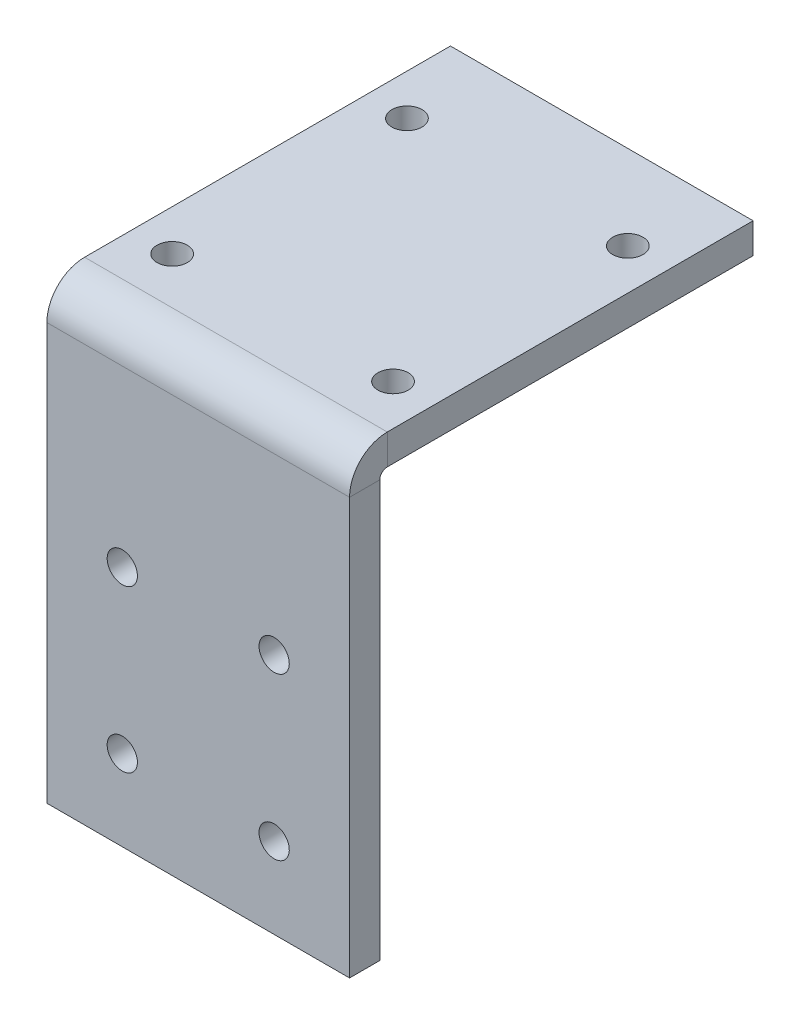
from build123d import *

# Parameters (mm, degrees)
SKETCH1_W                    = 30
SKETCH1_H                    = 40
BASE_FLANGE1_DEPTH           = 3
EDGE_FLANGE1_STRIP_W         = 13.4732
EDGE_FLANGE1_STRIP_H         = 3
EDGE_FLANGE1_STRIP_CUT_DEPTH = 30
EDGE_FLANGE1_DEPTH           = 30
SKETCH9_R                    = 1.5
CUT_EXTRUDE1_DEPTH           = 10
SKETCH10_R                   = 1.5
CUT_EXTRUDE2_DEPTH           = 10


# Sheet-metal steps are written as plain solids
with BuildPart() as part:
    # Sketch1 → Base-Flange1 (new body)
    with BuildSketch(Plane(origin=(0, 0, 0), x_dir=(1, 0, 0), z_dir=(0, 1, 0))):
        Rectangle(SKETCH1_W, SKETCH1_H)
    extrude(amount=-BASE_FLANGE1_DEPTH)

    # Edge-Flange1 strip (across the edge) → Edge-Flange1 strip cut (cut)
    with BuildSketch(Plane(origin=(15, -3, 20), x_dir=(0, 0, -1), z_dir=(-1, 0, 0))):
        with Locations((-3, -1.5)):
            Rectangle(EDGE_FLANGE1_STRIP_W, EDGE_FLANGE1_STRIP_H)
    extrude(amount=EDGE_FLANGE1_STRIP_CUT_DEPTH, mode=Mode.SUBTRACT)

    # Edge-Flange1 section (across the edge) → Edge-Flange1 (add)
    with BuildSketch(Plane(origin=(15, -3, 20), x_dir=(0, 0, -1), z_dir=(-1, 0, 0))):
        with BuildLine():
            Line((0, 0.7366), (0, 42))
            Line((0, 42), (3, 42))
            Line((3, 42), (3, 0.7366))
            ThreePointArc((3, 0.7366), (3.215745145, 0.215745145), (3.7366, 0))
            Line((3.7366, 0), (3.7366, -3))
            ThreePointArc((3.7366, -3), (1.094424801, -1.905575199), (0, 0.7366))
        make_face()
    extrude(amount=EDGE_FLANGE1_DEPTH)

    # Sketch9 → Cut-Extrude1 (cut)
    with BuildSketch(Plane.XY.offset(20)):
        with Locations((-7.525698427, -21)):
            Circle(SKETCH9_R)
        with Locations((-7.525698427, -37)):
            Circle(SKETCH9_R)
        with Locations(Location((7.525698427, -37, 0), (0, 0, 90))):
            Circle(SKETCH9_R)
        with Locations(Location((7.525698427, -21, 0), (0, 0, 90))):
            Circle(SKETCH9_R)
    extrude(amount=-CUT_EXTRUDE1_DEPTH, mode=Mode.SUBTRACT)

    # Sketch10 → Cut-Extrude2 (cut)
    with BuildSketch(Plane.XZ.offset(3)):
        with Locations(Location((-10.947470665, 11.635125857, 0), (0, 0, 270))):
            Circle(SKETCH10_R)
        with Locations(Location((10.947470665, 11.635125857, 0), (0, 0, 90))):
            Circle(SKETCH10_R)
        with Locations(Location((10.947470665, -11.635125857, 0), (0, 0, 270))):
            Circle(SKETCH10_R)
        with Locations(Location((-10.947470665, -11.635125857, 0), (0, 0, 90))):
            Circle(SKETCH10_R)
    extrude(amount=-CUT_EXTRUDE2_DEPTH, mode=Mode.SUBTRACT)


solid = part.part
